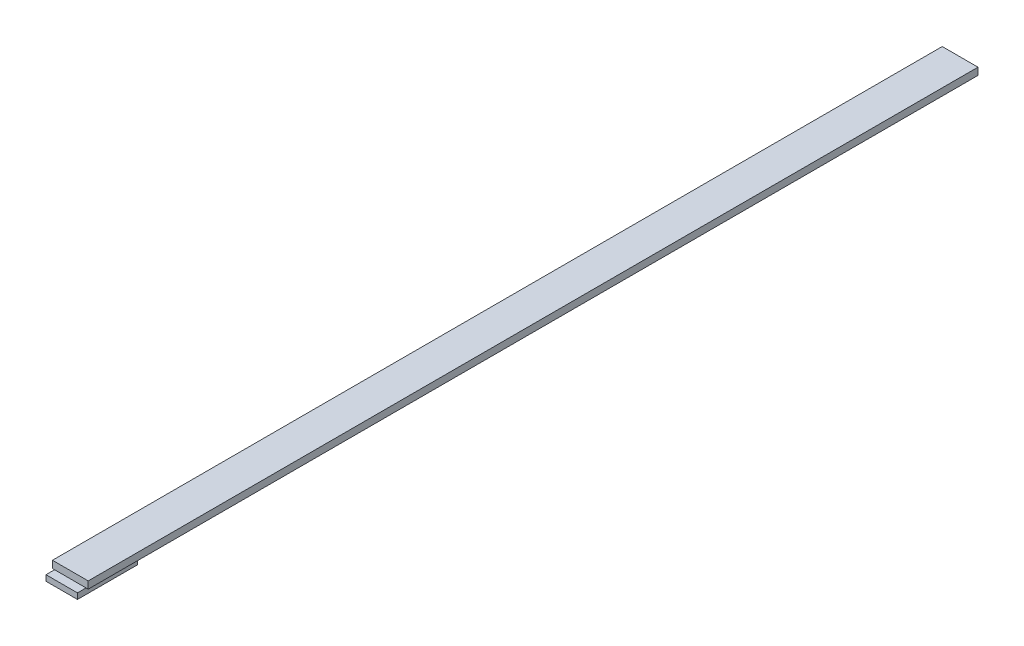
from build123d import *

# Parameters (mm, degrees)
SKETCH1_W           = 12.5
SKETCH1_H           = 2.5
BOSS_EXTRUDE1_DEPTH = 311
SKETCH4_W           = 11
SKETCH4_H           = 21
BOSS_EXTRUDE2_DEPTH = 2


with BuildPart() as part:
    # Sketch1 → Boss-Extrude1 (new body)
    with BuildSketch(Plane.XY):
        with Locations((6.25, 1.25)):
            Rectangle(SKETCH1_W, SKETCH1_H)
    extrude(amount=BOSS_EXTRUDE1_DEPTH)

    # Sketch4 → Boss-Extrude2 (add)
    with BuildSketch(Plane.XZ):
        with Locations((6.25, 303.5)):
            Rectangle(SKETCH4_W, SKETCH4_H)
    extrude(amount=BOSS_EXTRUDE2_DEPTH)


solid = part.part
